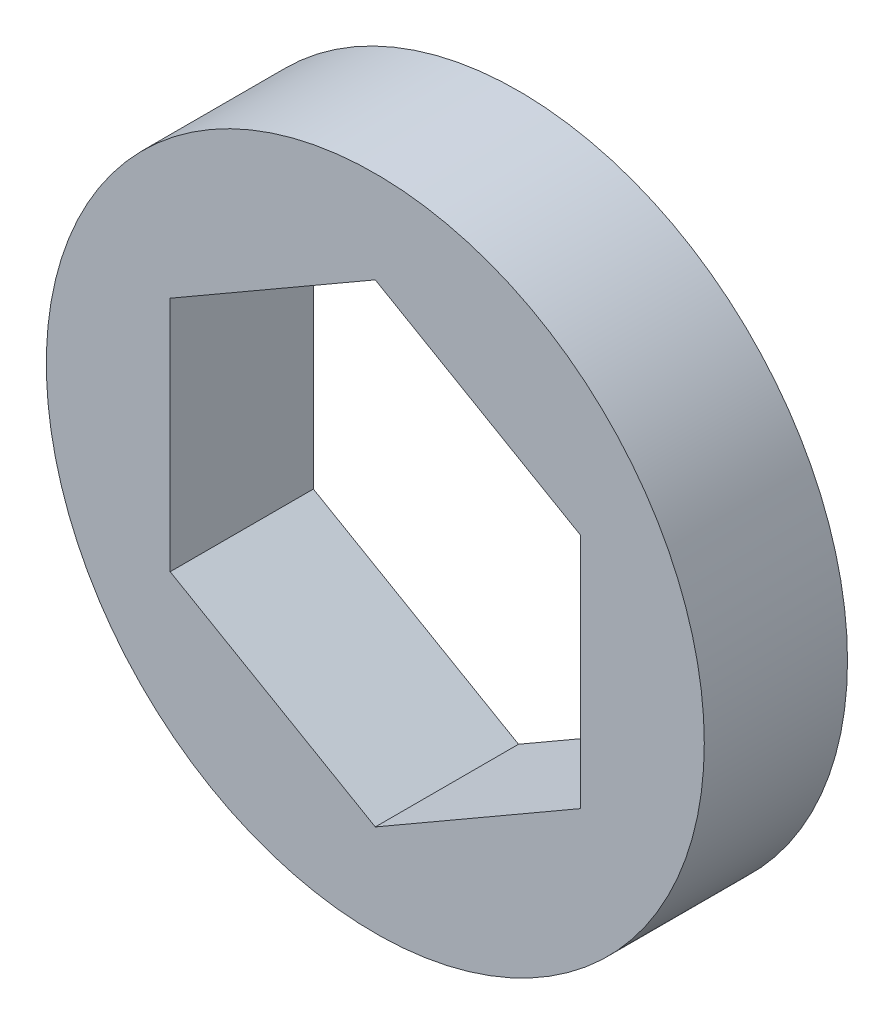
from build123d import *

# Parameters (mm, degrees)
SKETCH1_R           = 10.795
BOSS_EXTRUDE1_DEPTH = 4.699


with BuildPart() as part:
    # Sketch1 → Boss-Extrude1 (new body)
    with BuildSketch(Plane.XY):
        Circle(SKETCH1_R)
        Polygon((0, 7.772289324), (-6.731, 3.886144662), (-6.731, -3.886144662), (0, -7.772289324), (6.731, -3.886144662), (6.731, 3.886144662), align=None, mode=Mode.SUBTRACT)
    extrude(amount=BOSS_EXTRUDE1_DEPTH)


solid = part.part
